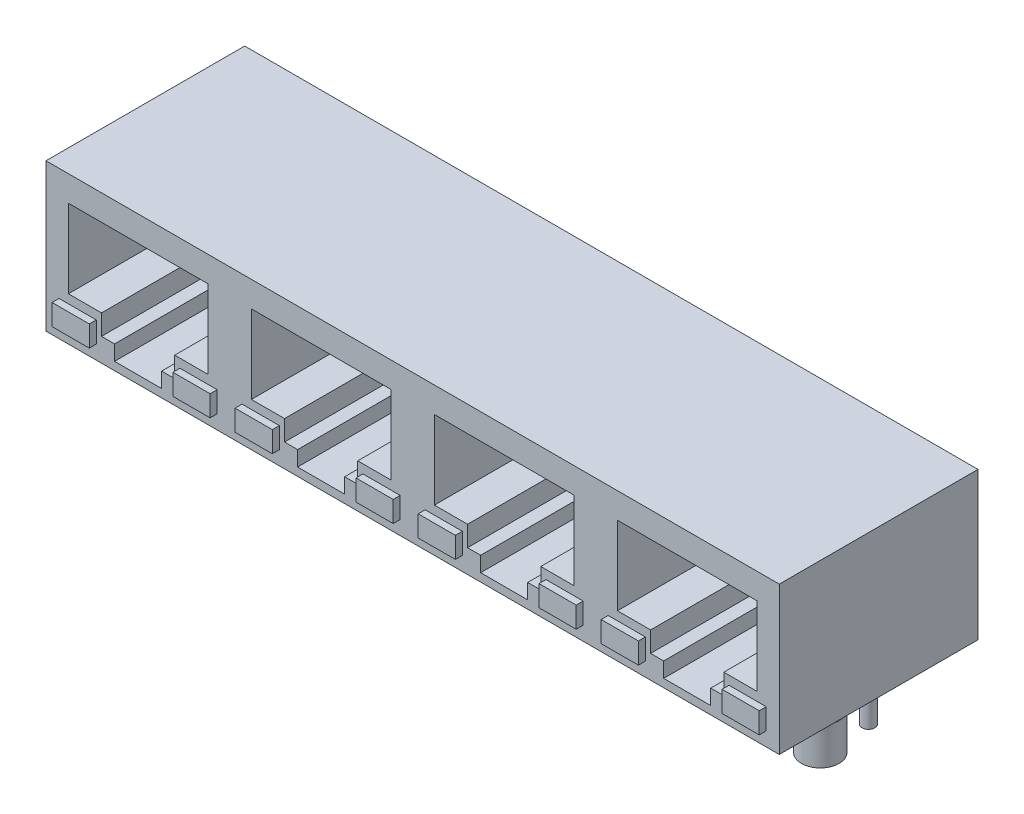
from build123d import *

# Parameters (mm, degrees)
CUT_EXTRUDE_START            = -21.2
CUT_EXTRUDE_1_OUTLINE_W      = 16
CUT_EXTRUDE_1_OUTLINE_H      = 13
CUT_EXTRUDE_1_DEPTH          = 20.4
CUT_EXTRUDE_START_2          = -10.6
CUT_EXTRUDE_1_2_DEPTH        = 9.8
CUT_EXTRUDE_START_3          = -21.3
CUT_EXTRUDE_1_3_OUTLINE_W    = 16
CUT_EXTRUDE_1_3_OUTLINE_H    = 13
CUT_EXTRUDE_1_3_OUTLINE_W_2  = 3.2
CUT_EXTRUDE_1_3_OUTLINE_H_2  = 1.8
CUT_EXTRUDE_1_3_DEPTH        = 0.1
SKETCH_2_W                   = 20.5
SKETCH_2_H                   = 13
CUT_EXTRUDE_2_DEPTH          = 0.4
SKETCH_3_W                   = 20.5
SKETCH_3_H                   = 13
CUT_EXTRUDE_3_DEPTH          = 0.4
SKETCH_8_W                   = 15.2
SKETCH_8_H                   = 13
CUT_EXTRUDE_4_DEPTH          = 3.4
MOVE_FACE_1_BY               = 0.7
MOVE_FACE_1_2_BY             = 0.7
SKETCH_10_W                  = 15.2
SKETCH_10_H                  = 17.1
CUT_EXTRUDE_5_DEPTH          = 0.3
SKETCH_7_W                   = 63.1
SKETCH_7_H                   = 17.1
EXTRUDE_2_DEPTH              = 12.7
MOVE_FACE_2_OUTLINE_W        = 0.325
MOVE_FACE_2_OUTLINE_H        = 1.8
MOVE_FACE_2_DEPTH            = 0.6
MOVE_START                   = -1
MOVE_FACE_2_2_OUTLINE_W      = 0.325
MOVE_FACE_2_2_OUTLINE_H      = 1.8
MOVE_FACE_2_2_DEPTH          = 1.6
PATTERN_START                = 9.275
PATTERN_LINEAR_8_OUTLINE_W   = 1.8
PATTERN_LINEAR_8_OUTLINE_H   = 0.6
PATTERN_LINEAR_8_DEPTH       = 3.2
PATTERN_START_2              = 19.675
PATTERN_LINEAR_8_2_OUTLINE_W = 1.8
PATTERN_LINEAR_8_2_OUTLINE_H = 0.6
PATTERN_LINEAR_8_2_DEPTH     = 3.2
PATTERN_START_3              = 25.025
PATTERN_LINEAR_8_3_OUTLINE_W = 1.8
PATTERN_LINEAR_8_3_OUTLINE_H = 0.6
PATTERN_LINEAR_8_3_DEPTH     = 3.2
PATTERN_START_4              = 35.425
PATTERN_LINEAR_8_4_OUTLINE_W = 1.8
PATTERN_LINEAR_8_4_OUTLINE_H = 0.6
PATTERN_LINEAR_8_4_DEPTH     = 3.2
PATTERN_START_5              = 40.775
PATTERN_LINEAR_8_5_OUTLINE_W = 1.8
PATTERN_LINEAR_8_5_OUTLINE_H = 0.6
PATTERN_LINEAR_8_5_DEPTH     = 3.2
PATTERN_START_6              = 51.175
PATTERN_LINEAR_8_6_OUTLINE_W = 1.8
PATTERN_LINEAR_8_6_OUTLINE_H = 0.6
PATTERN_LINEAR_8_6_DEPTH     = 3.2
CUT_EXTRUDE_6_DEPTH          = 10
SKETCH_5_R                   = 1.625
SKETCH_5_R_2                 = 0.55
SKETCH_5_R_3                 = 0.445
EXTRUDE_1_DEPTH              = 3.2


with BuildPart() as part:
    # 除料-伸長1: read off the stored shape, not the designer's step
    # 除料-伸長1 outline → 除料-伸長1 (new body)
    with BuildSketch(Plane(origin=(0, 0, -21.3), x_dir=(-1, 0, 0), z_dir=(0, 0, -1)).offset(CUT_EXTRUDE_START)):
        with Locations((0, -4)):
            Rectangle(CUT_EXTRUDE_1_OUTLINE_W, CUT_EXTRUDE_1_OUTLINE_H)
        Polygon((-2.025, -8.5), (-3.15, -8.5), (-3.15, -6.75), (-6, -6.75), (-6, 0), (6, 0), (6, -6.75), (3.15, -6.75), (3.15, -8.5), (2.025, -8.5), (2.025, -9.8), (-2.025, -9.8), align=None, mode=Mode.SUBTRACT)
    extrude(amount=CUT_EXTRUDE_1_DEPTH)

    # Cut-Extrude 1 2 outline → Cut-Extrude 1 2 (add)
    with BuildSketch(Plane(origin=(0, 0, -21.3), x_dir=(-1, 0, 0), z_dir=(0, 0, -1)).offset(CUT_EXTRUDE_START_2)):
        Polygon((-3.15, -6.75), (-3.15, -8.5), (-2.025, -8.5), (-2.025, -9.8), (2.025, -9.8), (2.025, -8.5), (3.15, -8.5), (3.15, -6.75), (6, -6.75), (6, 0), (-6, 0), (-6, -6.75), align=None)
    extrude(amount=CUT_EXTRUDE_1_2_DEPTH)

    # Cut-Extrude 1 3 outline → Cut-Extrude 1 3 (add)
    with BuildSketch(Plane(origin=(0, 0, -21.3), x_dir=(-1, 0, 0), z_dir=(0, 0, -1)).offset(CUT_EXTRUDE_START_3)):
        with Locations((0, -4)):
            Rectangle(CUT_EXTRUDE_1_3_OUTLINE_W, CUT_EXTRUDE_1_3_OUTLINE_H)
        with Locations((-5.2, -8.4)):
            Rectangle(CUT_EXTRUDE_1_3_OUTLINE_W_2, CUT_EXTRUDE_1_3_OUTLINE_H_2, mode=Mode.SUBTRACT)
        with Locations((5.2, -8.4)):
            Rectangle(CUT_EXTRUDE_1_3_OUTLINE_W_2, CUT_EXTRUDE_1_3_OUTLINE_H_2, mode=Mode.SUBTRACT)
        Polygon((-2.025, -8.5), (-3.15, -8.5), (-3.15, -6.75), (-6, -6.75), (-6, 0), (6, 0), (6, -6.75), (3.15, -6.75), (3.15, -8.5), (2.025, -8.5), (2.025, -9.8), (-2.025, -9.8), align=None, mode=Mode.SUBTRACT)
    extrude(amount=CUT_EXTRUDE_1_3_DEPTH)

    # 草圖2 → 除料-伸長2 (cut)
    with BuildSketch(Plane(origin=(8, 0, 0), x_dir=(0, 0, -1), z_dir=(1, 0, 0))):
        with Locations((10.25, -4)):
            Rectangle(SKETCH_2_W, SKETCH_2_H)
    extrude(amount=-CUT_EXTRUDE_2_DEPTH, mode=Mode.SUBTRACT)

    # 草圖3 → 除料-伸長3 (cut)
    with BuildSketch(Plane.ZY.offset(8)):
        with Locations((-10.25, -4)):
            Rectangle(SKETCH_3_W, SKETCH_3_H)
    extrude(amount=-CUT_EXTRUDE_3_DEPTH, mode=Mode.SUBTRACT)

    # 草圖8 → 除料-伸長4 (cut)
    with BuildSketch(Plane(origin=(0, 0, -20.5), x_dir=(-1, 0, 0), z_dir=(0, 0, -1))):
        with Locations((0, -4)):
            Rectangle(SKETCH_8_W, SKETCH_8_H)
    extrude(amount=-CUT_EXTRUDE_4_DEPTH, mode=Mode.SUBTRACT)

    # Move Face 1: a face moved outward by 0.7
    extrude(part.faces().sort_by_distance((5.2, -8.4, -0.1))[0], amount=MOVE_FACE_1_BY, dir=(0, 0, 1))

    # Move Face 1 2: a face moved outward by 0.7
    extrude(part.faces().sort_by_distance((-5.2, -8.4, -0.1))[0], amount=MOVE_FACE_1_2_BY, dir=(0, 0, 1))

    # 草圖10 → 除料-伸長5 (cut)
    with BuildSketch(Plane(origin=(0, 2.5, 0), x_dir=(1, 0, 0), z_dir=(0, 1, 0))):
        with Locations((0, 8.55)):
            Rectangle(SKETCH_10_W, SKETCH_10_H)
    extrude(amount=-CUT_EXTRUDE_5_DEPTH, mode=Mode.SUBTRACT)

    # 草圖7 → 填料-伸長2 (add)
    with BuildSketch(Plane(origin=(0, -10.5, 0), x_dir=(1, 0, 0), z_dir=(0, 1, 0))):
        with Locations((23.95, 8.55)):
            Rectangle(SKETCH_7_W, SKETCH_7_H)
    extrude(amount=EXTRUDE_2_DEPTH)

    # Move Face 2: read off the stored shape, not the designer's step
    # Move Face 2 outline → Move Face 2 (cut)
    with BuildSketch(Plane.XY):
        with Locations((-6.6375, -8.4)):
            Rectangle(MOVE_FACE_2_OUTLINE_W, MOVE_FACE_2_OUTLINE_H)
        with Locations((3.7625, -8.4)):
            Rectangle(MOVE_FACE_2_OUTLINE_W, MOVE_FACE_2_OUTLINE_H)
    extrude(amount=MOVE_FACE_2_DEPTH, mode=Mode.SUBTRACT)

    # Move Face 2 2 outline → Move Face 2 2 (add)
    with BuildSketch(Plane.XY.offset(MOVE_START)):
        with Locations((-3.4375, -8.4)):
            Rectangle(MOVE_FACE_2_2_OUTLINE_W, MOVE_FACE_2_2_OUTLINE_H)
        with Locations((6.9625, -8.4)):
            Rectangle(MOVE_FACE_2_2_OUTLINE_W, MOVE_FACE_2_2_OUTLINE_H)
    extrude(amount=MOVE_FACE_2_2_DEPTH)

    # 直線複製排列8: read off the stored shape, not the designer's step
    # 直線複製排列8 outline → 直線複製排列8 (add)
    with BuildSketch(Plane.YZ.offset(PATTERN_START)):
        with Locations((-8.4, 0.3)):
            Rectangle(PATTERN_LINEAR_8_OUTLINE_W, PATTERN_LINEAR_8_OUTLINE_H)
    extrude(amount=PATTERN_LINEAR_8_DEPTH)

    # Pattern Linear 8 2 outline → Pattern Linear 8 2 (add)
    with BuildSketch(Plane.YZ.offset(PATTERN_START_2)):
        with Locations((-8.4, 0.3)):
            Rectangle(PATTERN_LINEAR_8_2_OUTLINE_W, PATTERN_LINEAR_8_2_OUTLINE_H)
    extrude(amount=PATTERN_LINEAR_8_2_DEPTH)

    # Pattern Linear 8 3 outline → Pattern Linear 8 3 (add)
    with BuildSketch(Plane.YZ.offset(PATTERN_START_3)):
        with Locations((-8.4, 0.3)):
            Rectangle(PATTERN_LINEAR_8_3_OUTLINE_W, PATTERN_LINEAR_8_3_OUTLINE_H)
    extrude(amount=PATTERN_LINEAR_8_3_DEPTH)

    # Pattern Linear 8 4 outline → Pattern Linear 8 4 (add)
    with BuildSketch(Plane.YZ.offset(PATTERN_START_4)):
        with Locations((-8.4, 0.3)):
            Rectangle(PATTERN_LINEAR_8_4_OUTLINE_W, PATTERN_LINEAR_8_4_OUTLINE_H)
    extrude(amount=PATTERN_LINEAR_8_4_DEPTH)

    # Pattern Linear 8 5 outline → Pattern Linear 8 5 (add)
    with BuildSketch(Plane.YZ.offset(PATTERN_START_5)):
        with Locations((-8.4, 0.3)):
            Rectangle(PATTERN_LINEAR_8_5_OUTLINE_W, PATTERN_LINEAR_8_5_OUTLINE_H)
    extrude(amount=PATTERN_LINEAR_8_5_DEPTH)

    # Pattern Linear 8 6 outline → Pattern Linear 8 6 (add)
    with BuildSketch(Plane.YZ.offset(PATTERN_START_6)):
        with Locations((-8.4, 0.3)):
            Rectangle(PATTERN_LINEAR_8_6_OUTLINE_W, PATTERN_LINEAR_8_6_OUTLINE_H)
    extrude(amount=PATTERN_LINEAR_8_6_DEPTH)

    # 草圖9 → 除料-伸長6 (cut)
    with BuildSketch(Plane(origin=(0.325, 0, 0), x_dir=(1, 0, 0), z_dir=(0, 0, 1))):
        Polygon((21.75, -6.75), (21.75, 0), (9.75, 0), (9.75, -6.75), (12.6, -6.75), (12.6, -8.5), (13.725, -8.5), (13.725, -9.8), (17.775, -9.8), (17.775, -8.5), (18.9, -8.5), (18.9, -6.75), align=None)
        Polygon((37.5, -6.75), (37.5, 0), (25.5, 0), (25.5, -6.75), (28.35, -6.75), (28.35, -8.5), (29.475, -8.5), (29.475, -9.8), (33.525, -9.8), (33.525, -8.5), (34.65, -8.5), (34.65, -6.75), align=None)
        Polygon((6, -6.75), (6, 0), (-6, 0), (-6, -6.75), (-3.15, -6.75), (-3.15, -8.5), (-2.025, -8.5), (-2.025, -9.8), (2.025, -9.8), (2.025, -8.5), (3.15, -8.5), (3.15, -6.75), align=None)
        Polygon((53.25, -6.75), (53.25, 0), (41.25, 0), (41.25, -6.75), (44.1, -6.75), (44.1, -8.5), (45.225, -8.5), (45.225, -9.8), (49.275, -9.8), (49.275, -8.5), (50.4, -8.5), (50.4, -6.75), align=None)
    extrude(amount=-CUT_EXTRUDE_6_DEPTH, mode=Mode.SUBTRACT)

    # 草圖5 → 填料-伸長1 (add)
    with BuildSketch(Plane.XZ.offset(10.5)):
        with Locations(Location((-6.02, -5.11, 0), (0, 0, 166.484735487))):
            Circle(SKETCH_5_R)
        with Locations(Location((53.92, -5.11, 0), (0, 0, 13.515264513))):
            Circle(SKETCH_5_R)
        with Locations(Location((6.625, -9.3, 0), (0, 0, 270))):
            Circle(SKETCH_5_R_2)
        with Locations(Location((4.085, -9.3, 0), (0, 0, 270))):
            Circle(SKETCH_5_R_2)
        with Locations(Location((-4.085, -9.3, 0), (0, 0, 270))):
            Circle(SKETCH_5_R_2)
        with Locations(Location((-6.625, -9.3, 0), (0, 0, 270))):
            Circle(SKETCH_5_R_2)
        with Locations(Location((-4.445, -13.36, 0), (0, 0, 270))):
            Circle(SKETCH_5_R_3)
        with Locations(Location((-1.905, -13.36, 0), (0, 0, 270))):
            Circle(SKETCH_5_R_3)
        with Locations(Location((0.635, -13.36, 0), (0, 0, 270))):
            Circle(SKETCH_5_R_3)
        with Locations(Location((3.175, -13.36, 0), (0, 0, 270))):
            Circle(SKETCH_5_R_3)
        with Locations(Location((-3.175, -15.9, 0), (0, 0, 270))):
            Circle(SKETCH_5_R_3)
        with Locations(Location((-0.635, -15.9, 0), (0, 0, 270))):
            Circle(SKETCH_5_R_3)
        with Locations(Location((1.905, -15.9, 0), (0, 0, 270))):
            Circle(SKETCH_5_R_3)
        with Locations(Location((4.445, -15.9, 0), (0, 0, 270))):
            Circle(SKETCH_5_R_3)
        with Locations(Location((22.375, -9.3, 0), (0, 0, 270))):
            Circle(SKETCH_5_R_2)
        with Locations(Location((19.835, -9.3, 0), (0, 0, 270))):
            Circle(SKETCH_5_R_2)
        with Locations(Location((11.665, -9.3, 0), (0, 0, 270))):
            Circle(SKETCH_5_R_2)
        with Locations(Location((9.125, -9.3, 0), (0, 0, 270))):
            Circle(SKETCH_5_R_2)
        with Locations(Location((11.305, -13.36, 0), (0, 0, 270))):
            Circle(SKETCH_5_R_3)
        with Locations(Location((13.845, -13.36, 0), (0, 0, 270))):
            Circle(SKETCH_5_R_3)
        with Locations(Location((16.385, -13.36, 0), (0, 0, 270))):
            Circle(SKETCH_5_R_3)
        with Locations(Location((18.925, -13.36, 0), (0, 0, 270))):
            Circle(SKETCH_5_R_3)
        with Locations(Location((12.575, -15.9, 0), (0, 0, 270))):
            Circle(SKETCH_5_R_3)
        with Locations(Location((15.115, -15.9, 0), (0, 0, 270))):
            Circle(SKETCH_5_R_3)
        with Locations(Location((17.655, -15.9, 0), (0, 0, 270))):
            Circle(SKETCH_5_R_3)
        with Locations(Location((20.195, -15.9, 0), (0, 0, 270))):
            Circle(SKETCH_5_R_3)
        with Locations(Location((38.125, -9.3, 0), (0, 0, 270))):
            Circle(SKETCH_5_R_2)
        with Locations(Location((35.585, -9.3, 0), (0, 0, 270))):
            Circle(SKETCH_5_R_2)
        with Locations(Location((27.415, -9.3, 0), (0, 0, 270))):
            Circle(SKETCH_5_R_2)
        with Locations(Location((24.875, -9.3, 0), (0, 0, 270))):
            Circle(SKETCH_5_R_2)
        with Locations(Location((27.055, -13.36, 0), (0, 0, 270))):
            Circle(SKETCH_5_R_3)
        with Locations(Location((29.595, -13.36, 0), (0, 0, 270))):
            Circle(SKETCH_5_R_3)
        with Locations(Location((32.135, -13.36, 0), (0, 0, 270))):
            Circle(SKETCH_5_R_3)
        with Locations(Location((34.675, -13.36, 0), (0, 0, 270))):
            Circle(SKETCH_5_R_3)
        with Locations(Location((28.325, -15.9, 0), (0, 0, 270))):
            Circle(SKETCH_5_R_3)
        with Locations(Location((30.865, -15.9, 0), (0, 0, 270))):
            Circle(SKETCH_5_R_3)
        with Locations(Location((33.405, -15.9, 0), (0, 0, 270))):
            Circle(SKETCH_5_R_3)
        with Locations(Location((35.945, -15.9, 0), (0, 0, 270))):
            Circle(SKETCH_5_R_3)
        with Locations(Location((53.875, -9.3, 0), (0, 0, 270))):
            Circle(SKETCH_5_R_2)
        with Locations(Location((51.335, -9.3, 0), (0, 0, 270))):
            Circle(SKETCH_5_R_2)
        with Locations(Location((43.165, -9.3, 0), (0, 0, 270))):
            Circle(SKETCH_5_R_2)
        with Locations(Location((40.625, -9.3, 0), (0, 0, 270))):
            Circle(SKETCH_5_R_2)
        with Locations(Location((42.805, -13.36, 0), (0, 0, 270))):
            Circle(SKETCH_5_R_3)
        with Locations(Location((45.345, -13.36, 0), (0, 0, 270))):
            Circle(SKETCH_5_R_3)
        with Locations(Location((47.885, -13.36, 0), (0, 0, 270))):
            Circle(SKETCH_5_R_3)
        with Locations(Location((50.425, -13.36, 0), (0, 0, 270))):
            Circle(SKETCH_5_R_3)
        with Locations(Location((44.075, -15.9, 0), (0, 0, 270))):
            Circle(SKETCH_5_R_3)
        with Locations(Location((46.615, -15.9, 0), (0, 0, 270))):
            Circle(SKETCH_5_R_3)
        with Locations(Location((49.155, -15.9, 0), (0, 0, 270))):
            Circle(SKETCH_5_R_3)
        with Locations(Location((51.695, -15.9, 0), (0, 0, 270))):
            Circle(SKETCH_5_R_3)
    extrude(amount=EXTRUDE_1_DEPTH)


solid = part.part
